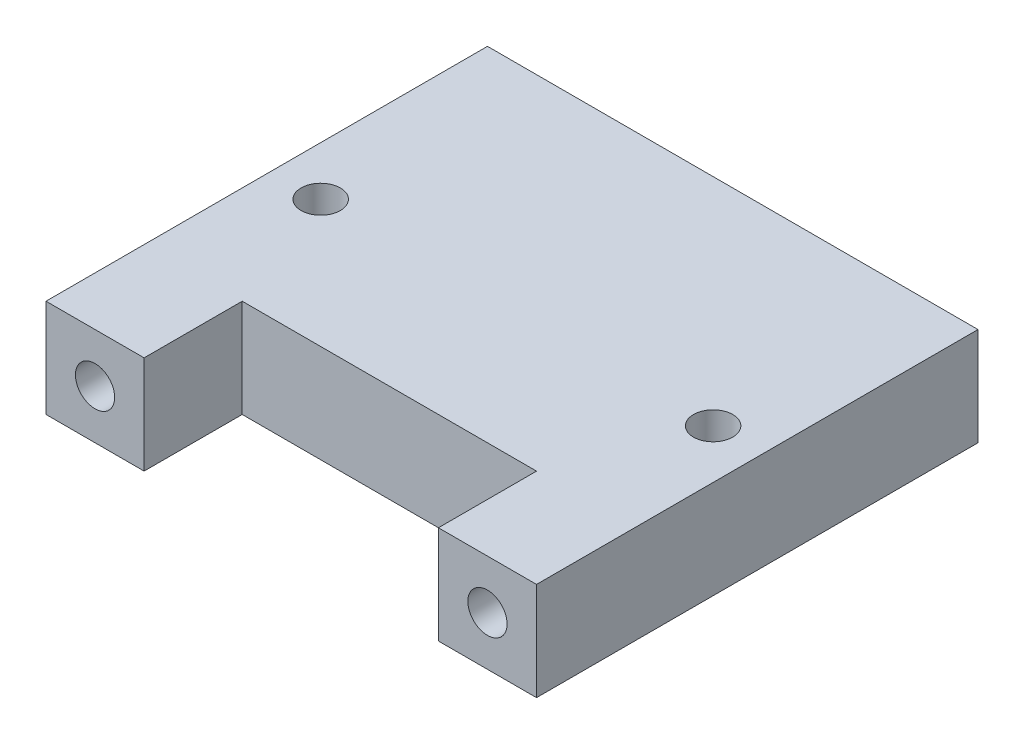
from build123d import *

# Parameters (mm, degrees)
BOSS_EXTRU_1_DEPTH      = 10
ESQUISSE2_R             = 2
ENL_V_MAT_EXTRU_1_DEPTH = 10
ENL_V_START             = -10
ESQUISSE3_R             = 2
ENL_V_MAT_EXTRU_2_DEPTH = 10
ESQUISSE4_R             = 2
ENL_V_MAT_EXTRU_3_DEPTH = 10
CHANFREIN1_SIZE         = 2.5


with BuildPart() as part:
    # Esquisse1 → Boss.-Extru.1 (new body)
    with BuildSketch(Plane(origin=(0, 0, 0), x_dir=(1, 0, 0), z_dir=(0, 1, 0))):
        Polygon((-47.148145082, 1.041666667), (-47.148145082, 11.041666667), (-17.148145082, 11.041666667), (-17.148145082, 1.041666667), (-7.148145082, 1.041666667), (-7.148145082, 16.041666667), (-7.148145082, 46.041666667), (-57.148145082, 46.041666667), (-57.148145082, 1.041666667), align=None)
    extrude(amount=BOSS_EXTRU_1_DEPTH)

    # Esquisse2 → Enlèv. mat.-Extru.1 (cut)
    with BuildSketch(Plane.XY.offset(-1.041666667)):
        with Locations((-52.148145082, 5)):
            Circle(ESQUISSE2_R)
        with Locations((-12.148145082, 5)):
            Circle(ESQUISSE2_R)
    extrude(amount=-ENL_V_MAT_EXTRU_1_DEPTH, mode=Mode.SUBTRACT)

    # Esquisse3 → Enlèv. mat.-Extru.2 (cut)
    with BuildSketch(Plane(origin=(0, 0, -46.041666667), x_dir=(-1, 0, 0), z_dir=(0, 0, -1)).offset(ENL_V_START)):
        with Locations((12.148145082, 5)):
            Circle(ESQUISSE3_R)
        with Locations((52.148145082, 5)):
            Circle(ESQUISSE3_R)
    extrude(amount=ENL_V_MAT_EXTRU_2_DEPTH, mode=Mode.SUBTRACT)

    # Esquisse4 → Enlèv. mat.-Extru.3 (cut)
    with BuildSketch(Plane(origin=(0, 10, 0), x_dir=(1, 0, 0), z_dir=(0, 1, 0))):
        with Locations((-52.148145082, 24.041666667)):
            Circle(ESQUISSE4_R)
        with Locations((-12.148145082, 24.041666667)):
            Circle(ESQUISSE4_R)
    extrude(amount=-ENL_V_MAT_EXTRU_3_DEPTH, mode=Mode.SUBTRACT)

    # Chanfrein1
    chanfrein1_edges = [part.edges().sort_by_distance(p)[0] for p in [
        (-54.148145082, 0, -24.041666667),
        (-14.148145082, 0, -24.041666667),
    ]]
    chamfer(chanfrein1_edges, length=CHANFREIN1_SIZE)


solid = part.part
